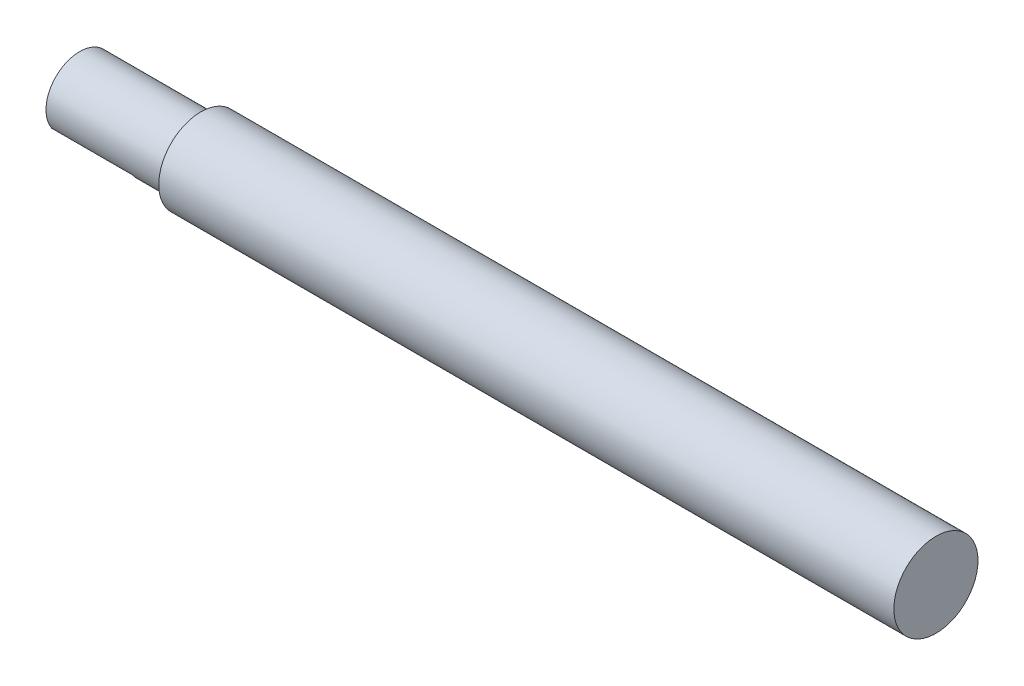
from build123d import *

# Parameters (mm, degrees)
SKETCH2_R           = 3.96875
BOSS_EXTRUDE1_DEPTH = 69.342
SKETCH3_R           = 3.175
BOSS_EXTRUDE2_DEPTH = 11.43
CUT_EXTRUDE1_DEPTH  = 7.62


with BuildPart() as part:
    # Sketch2 → Boss-Extrude1 (new body)
    with BuildSketch(Plane(origin=(0, 0, 0), x_dir=(0, 0, -1), z_dir=(1, 0, 0))):
        Circle(SKETCH2_R)
    extrude(amount=BOSS_EXTRUDE1_DEPTH)

    # Sketch3 → Boss-Extrude2 (add)
    with BuildSketch(Plane(origin=(0, 0, 0), x_dir=(0, 0, -1), z_dir=(1, 0, 0))):
        Circle(SKETCH3_R)
    extrude(amount=-BOSS_EXTRUDE2_DEPTH)

    # Sketch4 → Cut-Extrude1 (cut)
    with BuildSketch(Plane.ZY.offset(11.43)):
        Polygon((-2.630464028, -1.778), (2.630464028, -1.778), (3.028427561, -2.61948228), (1.395900731, -3.652283599), (-4.099286663, -3.460964559), align=None)
    extrude(amount=-CUT_EXTRUDE1_DEPTH, mode=Mode.SUBTRACT)


solid = part.part
